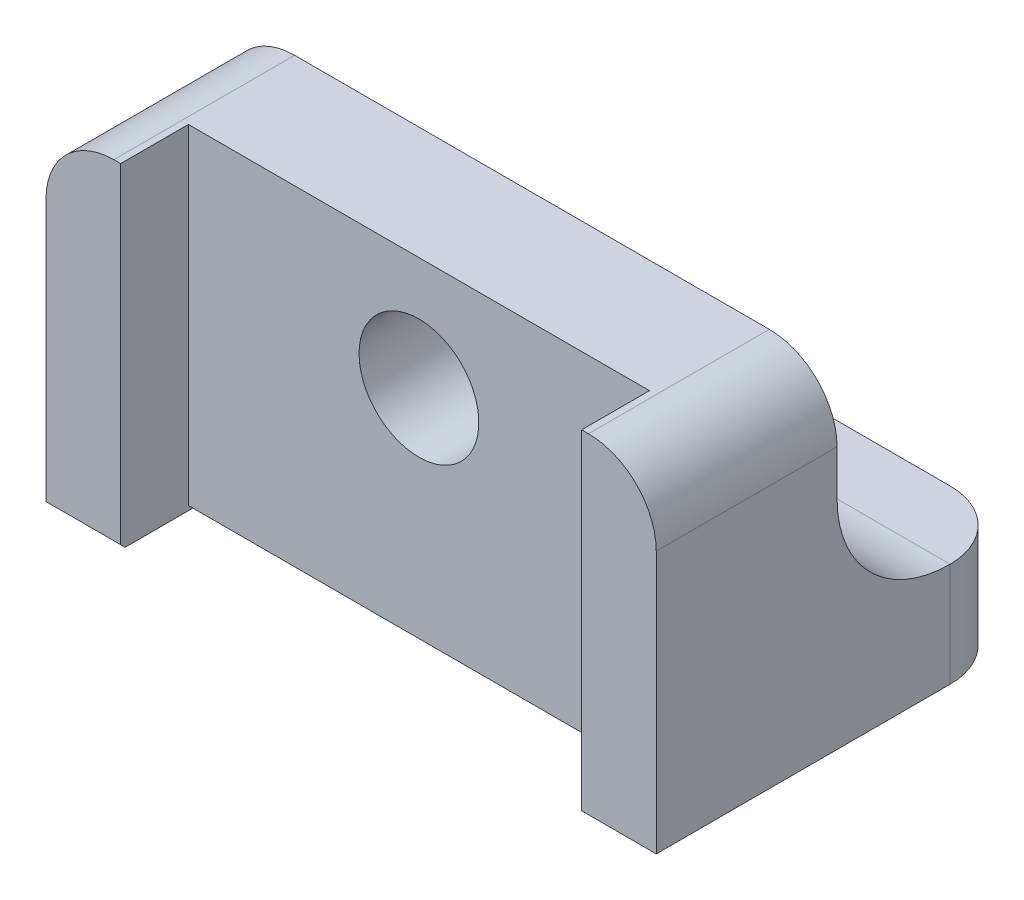
from build123d import *

# Parameters (mm, degrees)
BOSS_EXTRUDE1_DEPTH = 5
BOSS_EXTRUDE2_DEPTH = 10
FILLET1_R           = 5
FILLET2_R           = 3
SKETCH4_R           = 2.65
CUT_EXTRUDE1_DEPTH  = 22.708293346
SKETCH5_R           = 5
CUT_EXTRUDE2_DEPTH  = 22.708293346
CHAMFER1_SIZE       = 0.4
MOVE_START          = -10.2
MOVE_FACE1_DEPTH    = 20.4


with BuildPart() as part:
    # Sketch2 → Boss-Extrude1 (new body)
    with BuildSketch(Plane(origin=(0, 0, 0), x_dir=(1, 0, 0), z_dir=(0, 1, 0))):
        Polygon((-10, 10), (-10, 7), (-13.5, 7), (-13.5, 23), (13.5, 23), (13.5, 7), (10, 7), (10, 10), align=None)
    extrude(amount=BOSS_EXTRUDE1_DEPTH)

    # Sketch3 → Boss-Extrude2 (add)
    with BuildSketch(Plane(origin=(0, 5, 0), x_dir=(1, 0, 0), z_dir=(0, 1, 0))):
        Polygon((10, 7), (13.5, 7), (13.5, 15), (-13.5, 15), (-13.5, 7), (-10, 7), (-10, 10), (10, 10), align=None)
    extrude(amount=BOSS_EXTRUDE2_DEPTH)

    # Fillet1
    fillet1_edges = [part.edges().sort_by_distance(p)[0] for p in [
        (0, 5, -15),
    ]]
    fillet(fillet1_edges, radius=FILLET1_R)

    # Fillet2
    fillet2_edges = [part.edges().sort_by_distance(p)[0] for p in [
        (-13.5, 2.5, -23),
        (13.5, 2.5, -23),
        (-13.5, 15, -11),
        (13.5, 15, -11),
    ]]
    fillet(fillet2_edges, radius=FILLET2_R)

    # Sketch4 → Cut-Extrude1 (cut, through all)
    with BuildSketch(Plane(origin=(0, 0, -15), x_dir=(-1, 0, 0), z_dir=(0, 0, -1))):
        with Locations((0, 10)):
            Circle(SKETCH4_R)
    extrude(amount=-CUT_EXTRUDE1_DEPTH, mode=Mode.SUBTRACT)

    # Sketch5 → Cut-Extrude2 (cut, through all)
    with BuildSketch(Plane(origin=(0, 0, -15), x_dir=(-1, 0, 0), z_dir=(0, 0, -1))):
        with Locations((0, 10)):
            Circle(SKETCH5_R)
    extrude(amount=CUT_EXTRUDE2_DEPTH, mode=Mode.SUBTRACT)

    # Chamfer1
    chamfer1_edges = [part.edges().sort_by_distance(p)[0] for p in [
        (13.5, 0, -13.5),
        (11.75, 0, -7),
        (10, 0, -8.5),
        (-13.5, 0, -13.5),
        (0, 0, -23),
        (12.621320344, 0, -22.121320344),
        (-12.621320344, 0, -22.121320344),
        (0, 0, -10),
        (-10, 0, -8.5),
        (-11.75, 0, -7),
    ]]
    chamfer(chamfer1_edges, length=CHAMFER1_SIZE)

    # Move Face1: read off the stored shape, not the designer's step
    # Move Face1 outline → Move Face1 (cut)
    with BuildSketch(Plane.YZ.offset(MOVE_START)):
        Polygon((0.4, -10), (15, -10), (15, -7), (0.4, -7), (0.2, -7.2), (0.2, -10.2), align=None)
    extrude(amount=MOVE_FACE1_DEPTH, mode=Mode.SUBTRACT)


solid = part.part
